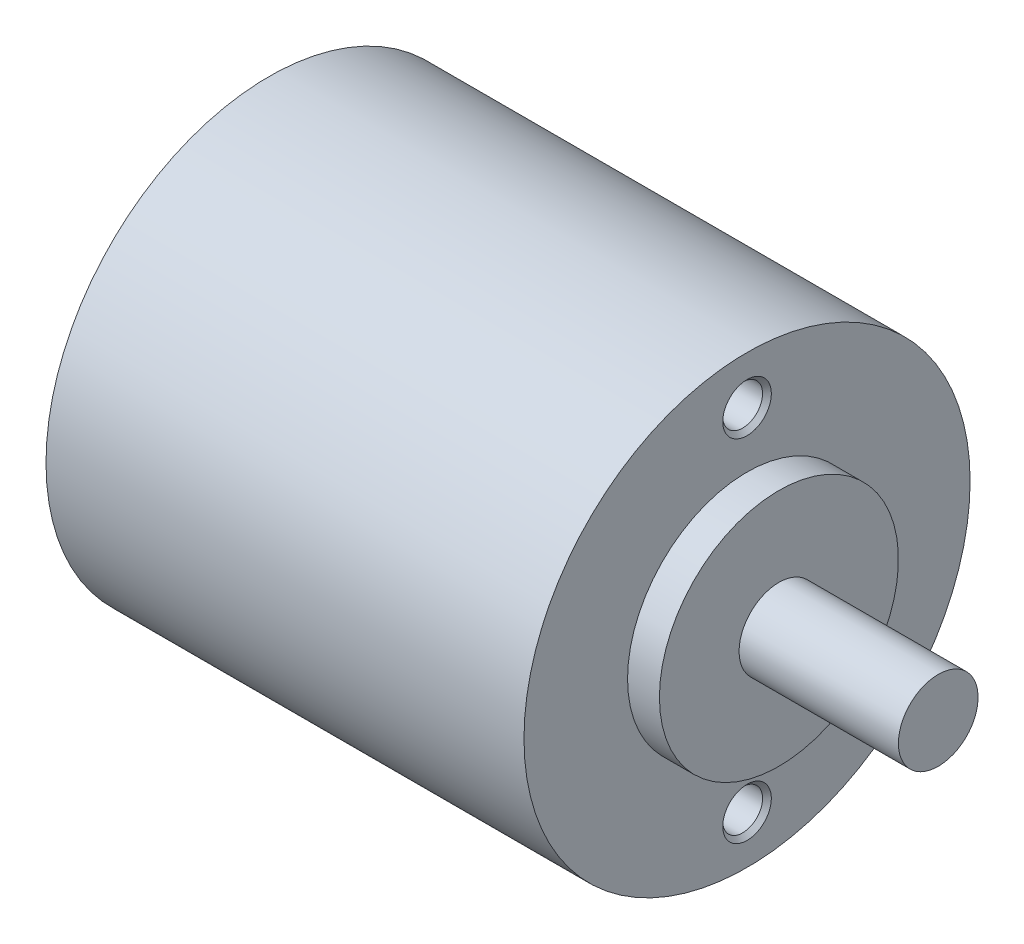
from build123d import *

# Parameters (mm, degrees)
TROU_TARAUD_M3X0_51_D           = 2.5
TROU_TARAUD_M3X0_51_DEPTH       = 8.5
TROU_TARAUD_M3X0_51_CSINK_D     = 3.05
TROU_TARAUD_M3X0_51_CSINK_ANGLE = 90
TROU_TARAUD_M3X0_51_TIP         = 0.751075774


with BuildPart() as part:
    # Esquisse1 → Révolution1 (revolve)
    with BuildSketch(Plane.XY):
        Polygon((12, 2.5), (12, 0), (-30, 0), (-30, 14), (0, 14), (0, 7.5), (2, 7.5), (2, 2.5), align=None)
    revolve(axis=Axis((-51.155053474, 0, 0), (1, 0, 0)))

    # Trou taraudé M3x0.51
    with Locations(Plane(origin=(0, 0, 0), x_dir=(0, 0, -1), z_dir=(1, 0, 0))):
        with Locations((0, 11), (0, -11)):
            CounterSinkHole(TROU_TARAUD_M3X0_51_D / 2, TROU_TARAUD_M3X0_51_CSINK_D / 2, depth=TROU_TARAUD_M3X0_51_DEPTH, counter_sink_angle=TROU_TARAUD_M3X0_51_CSINK_ANGLE)
            with Locations((0, 0, -(TROU_TARAUD_M3X0_51_DEPTH + TROU_TARAUD_M3X0_51_TIP / 2))):  # 118° drill point
                Cone(0, TROU_TARAUD_M3X0_51_D / 2, TROU_TARAUD_M3X0_51_TIP, mode=Mode.SUBTRACT)


solid = part.part
